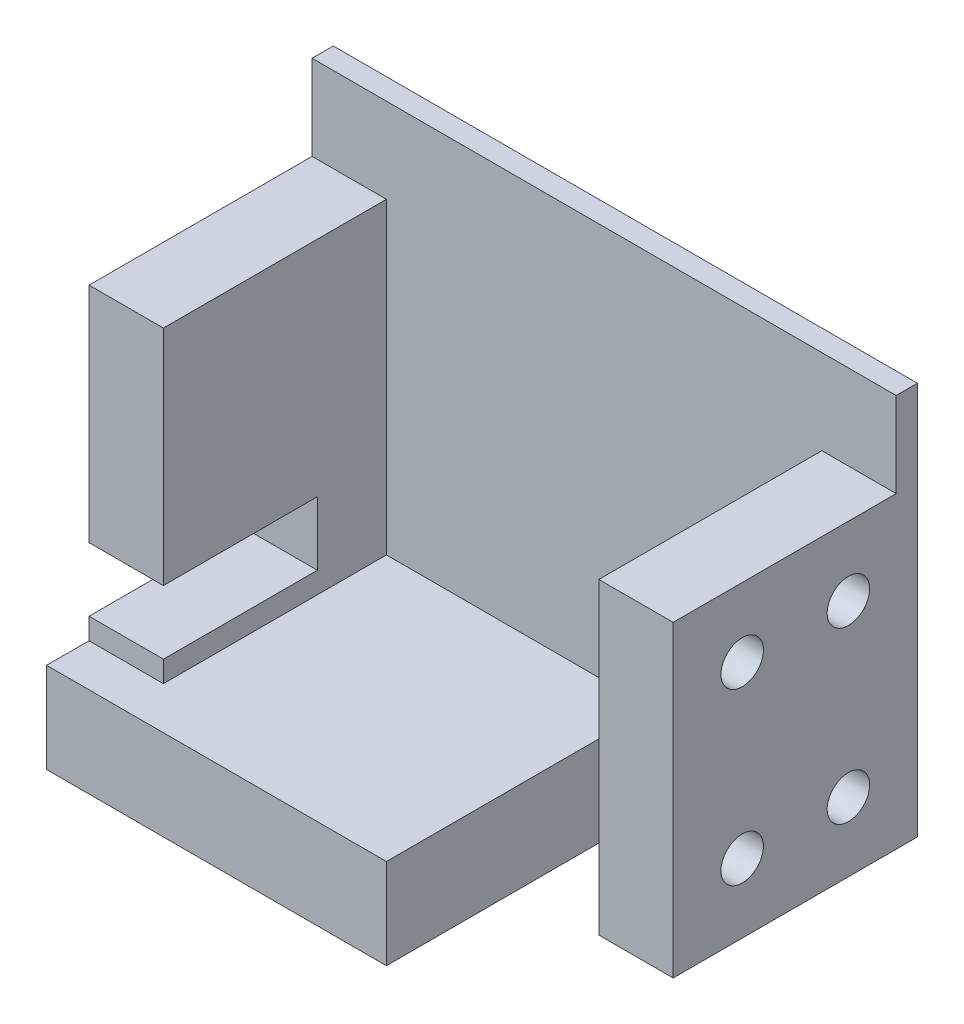
from build123d import *

# Parameters (mm, degrees)
SKETCH1_W            = 7
SKETCH1_H            = 29
SIDES_DEPTH          = 23
SIDES_2_DEPTH        = 23
BACK_PLATE_DEPTH     = 2
SKETCH2_W            = 32
SKETCH2_H            = 27
BEARING_BASE_DEPTH   = 1
SKETCH3_W            = 14.5
SKETCH3_H            = 6
WIRE_2_DEPTH         = 21
BEARING_START        = 1
BEARING_DEPTH        = 7.5
MOUTNING_HOLES_R     = 2
SCREW_HOLES_DEPTH    = 10
SCREW_START          = -4.5
MOUTNING_HOLES_3_R   = 4
MOUTNING_HOLES_3_R_2 = 2
SCREW_HEADS_DEPTH    = 2.5


# Read off the part's stored shape, not the designer's step: Bearing
with BuildPart() as part:
    # Sketch1 → Sides (new body)
    with BuildSketch(Plane.XY):
        with Locations((-28.331246011, 12.295832375)):
            Rectangle(SKETCH1_W, SKETCH1_H)
    extrude(amount=SIDES_DEPTH)



with BuildPart() as body_2:
    # Sketch1 → Sides 2 (new body)
    with BuildSketch(Plane.XY):
        with Locations((19.668753989, 12.295832375)):
            Rectangle(SKETCH1_W, SKETCH1_H)
    extrude(amount=SIDES_2_DEPTH)


with BuildPart() as part_1:
    add(part.part)

    add(body_2.part)  # Back Plate merges body 2
    # Sketch1<3> → Back Plate (add)
    with BuildSketch(Plane.XY):
        Polygon((-4.331246011, -2.204167625), (-4.331246011, 34.795832375), (-31.831246011, 34.795832375), (-31.831246011, 26.795832375), (-24.831246011, 26.795832375), (-24.831246011, -2.204167625), align=None)
        Polygon((23.168753989, 34.795832375), (-4.331246011, 34.795832375), (-4.331246011, -2.204167625), (16.168753989, -2.204167625), (16.168753989, 26.795832375), (23.168753989, 26.795832375), align=None)
    extrude(amount=BACK_PLATE_DEPTH)

    # Sketch2 → Bearing Base (add)
    with BuildSketch(Plane.XZ.offset(2.204167625)):
        with Locations((-15.831246011, 13.5)):
            Rectangle(SKETCH2_W, SKETCH2_H)
    extrude(amount=BEARING_BASE_DEPTH)

    # Sketch3 → Wire 2 (cut)
    with BuildSketch(Plane.ZY.offset(31.831246011)):
        with Locations((15.75, 2.795832375)):
            Rectangle(SKETCH3_W, SKETCH3_H)
    extrude(amount=-WIRE_2_DEPTH, mode=Mode.SUBTRACT)

    # Bearing outline → Bearing (add)
    with BuildSketch(Plane.XZ.offset(2.204167625).offset(BEARING_START)):
        with BuildLine():
            Line((-31.831246011, 27), (-31.831246011, 0))
            Line((-31.831246011, 0), (-18.189741294, 0))
            ThreePointArc((-18.189741294, 0), (-15.831246011, 22.25), (-13.472750728, 0))
            Line((-13.472750728, 0), (0.168753989, 0))
            Line((0.168753989, 0), (0.168753989, 27))
            Line((0.168753989, 27), (-31.831246011, 27))
        make_face()
    extrude(amount=BEARING_DEPTH)

    # Moutning Holes → Screw Holes (cut)
    with BuildSketch(Plane(origin=(23.168753989, 0, 0), x_dir=(0, 0, -1), z_dir=(1, 0, 0))):
        with Locations(Location((-6.5, 4.295832375, 0), (0, 0, 90))):
            Circle(MOUTNING_HOLES_R)
        with Locations(Location((-16.5, 4.295832375, 0), (0, 0, 90))):
            Circle(MOUTNING_HOLES_R)
        with Locations(Location((-16.5, 20.295832375, 0), (0, 0, 90))):
            Circle(MOUTNING_HOLES_R)
        with Locations(Location((-6.5, 20.295832375, 0), (0, 0, 90))):
            Circle(MOUTNING_HOLES_R)
    extrude(amount=-SCREW_HOLES_DEPTH, mode=Mode.SUBTRACT)

    # Moutning Holes<3> → Screw Heads (cut)
    # profile 1 of 4: a face of its own
    with BuildSketch(Plane(origin=(23.168753989, 0, 0), x_dir=(0, 0, -1), z_dir=(1, 0, 0)).offset(SCREW_START)):
        with Locations(Location((-6.5, 4.295832375, 0), (0, 0, 270))):
            Circle(MOUTNING_HOLES_3_R)
        with Locations(Location((-6.5, 4.295832375, 0), (0, 0, 90))):
            Circle(MOUTNING_HOLES_3_R_2, mode=Mode.SUBTRACT)
    # profile 2 of 4: a face of its own
    with BuildSketch(Plane(origin=(23.168753989, 0, 0), x_dir=(0, 0, -1), z_dir=(1, 0, 0)).offset(SCREW_START)):
        with Locations(Location((-16.5, 4.295832375, 0), (0, 0, 270))):
            Circle(MOUTNING_HOLES_3_R)
        with Locations(Location((-16.5, 4.295832375, 0), (0, 0, 90))):
            Circle(MOUTNING_HOLES_3_R_2, mode=Mode.SUBTRACT)
    # profile 3 of 4: a face of its own
    with BuildSketch(Plane(origin=(23.168753989, 0, 0), x_dir=(0, 0, -1), z_dir=(1, 0, 0)).offset(SCREW_START)):
        with Locations(Location((-16.5, 20.295832375, 0), (0, 0, 270))):
            Circle(MOUTNING_HOLES_3_R)
        with Locations(Location((-16.5, 20.295832375, 0), (0, 0, 90))):
            Circle(MOUTNING_HOLES_3_R_2, mode=Mode.SUBTRACT)
    # profile 4 of 4: a face of its own
    with BuildSketch(Plane(origin=(23.168753989, 0, 0), x_dir=(0, 0, -1), z_dir=(1, 0, 0)).offset(SCREW_START)):
        with Locations(Location((-6.5, 20.295832375, 0), (0, 0, 270))):
            Circle(MOUTNING_HOLES_3_R)
        with Locations(Location((-6.5, 20.295832375, 0), (0, 0, 90))):
            Circle(MOUTNING_HOLES_3_R_2, mode=Mode.SUBTRACT)
    extrude(amount=-SCREW_HEADS_DEPTH, mode=Mode.SUBTRACT)


solid = part_1.part
